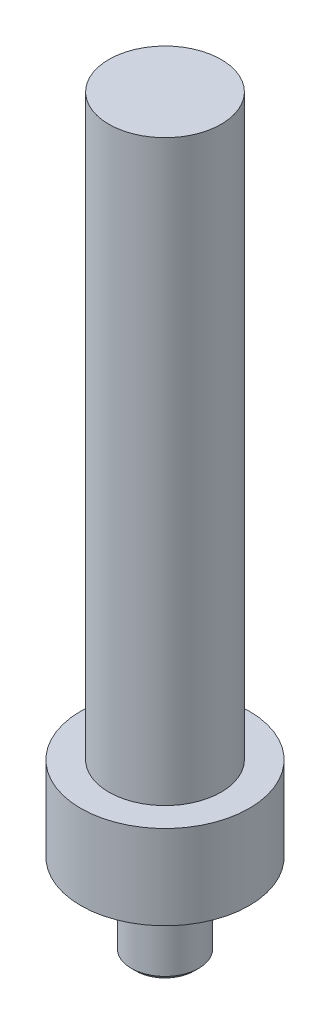
from build123d import *

# Parameters (mm, degrees)
SKETCH1_R           = 15
BOSS_EXTRUDE1_DEPTH = 15
SKETCH2_R           = 10
BOSS_EXTRUDE2_DEPTH = 103
SKETCH3_R           = 7.5
BOSS_EXTRUDE3_DEPTH = 15


# Read off the part's stored shape, not the designer's step: M12x1.5 Machine Threads Stud1
with BuildPart() as part:
    # Sketch1 → Boss-Extrude1 (new body)
    with BuildSketch(Plane(origin=(0, 0, 0), x_dir=(1, 0, 0), z_dir=(0, 1, 0))):
        with Locations(Location((0, 0, 0), (0, 0, 270))):
            Circle(SKETCH1_R)
    extrude(amount=BOSS_EXTRUDE1_DEPTH)

    # Sketch2 → Boss-Extrude2 (add)
    with BuildSketch(Plane(origin=(0, 15, 0), x_dir=(1, 0, 0), z_dir=(0, 1, 0))):
        with Locations(Location((0, 0, 0), (0, 0, 270))):
            Circle(SKETCH2_R)
    extrude(amount=BOSS_EXTRUDE2_DEPTH)

    # Sketch3 → Boss-Extrude3 (add)
    with BuildSketch(Plane.XZ):
        with Locations(Location((0, 0, 0), (0, 0, 270))):
            Circle(SKETCH3_R)
    extrude(amount=BOSS_EXTRUDE3_DEPTH)

    # M12x1.5 Machine Threads Stud1 outline → M12x1.5 Machine Threads Stud1 (revolve, cut)
    with BuildSketch(Plane.XY):
        Polygon((7.5, 0), (6, 0), (6, -14.172), (5.172, -15), (7.5, -15), align=None)
    revolve(axis=Axis((0, 0, 0), (0, 1, 0)), mode=Mode.SUBTRACT)


solid = part.part
